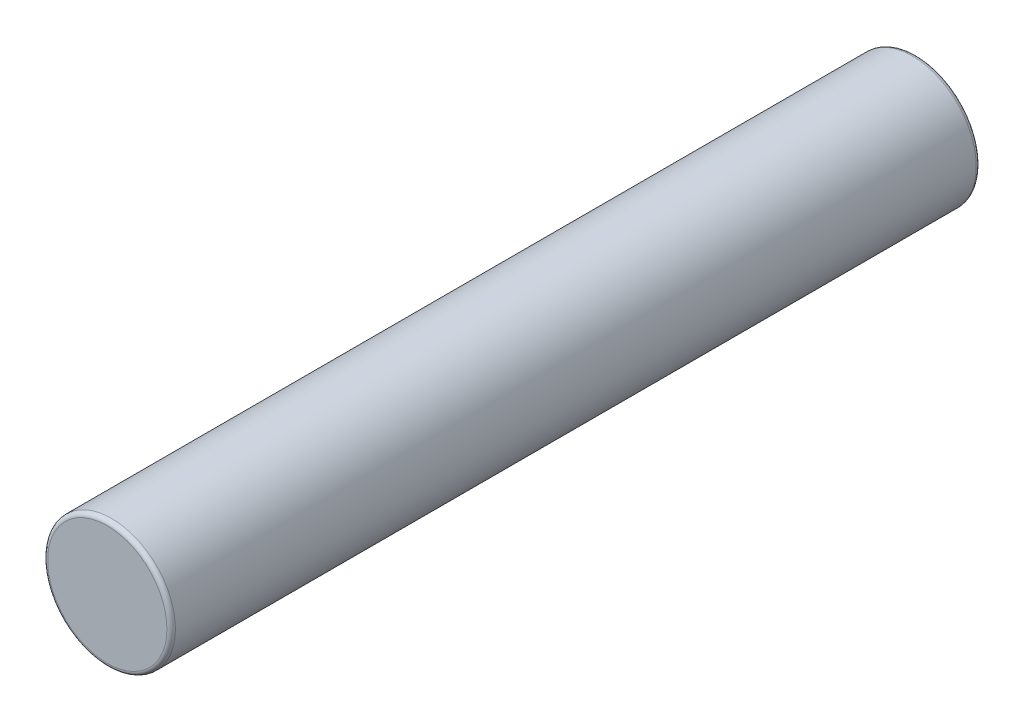
from build123d import *

# Parameters (mm, degrees)
SALIENTE_EXTRUIR1_DEPTH      = 4.75
SALIENTE_EXTRUIR1_DEPTH_BACK = 4.75
CROQUIS1_R                   = 0.75
REDONDEO1_R                  = 0.05


with BuildPart() as part:
    # Croquis1 → Saliente-Extruir1 (new, two sides: drawn at the far end of the back side and taken through both)
    with BuildSketch(Plane.XY.offset(-SALIENTE_EXTRUIR1_DEPTH_BACK)):
        Circle(CROQUIS1_R)
    extrude(amount=SALIENTE_EXTRUIR1_DEPTH + SALIENTE_EXTRUIR1_DEPTH_BACK)

    # Redondeo1
    redondeo1_edges = [part.edges().sort_by_distance(p)[0] for p in [
        (-0.75, 0, -4.75),
        (-0.75, 0, 4.75),
    ]]
    fillet(redondeo1_edges, radius=REDONDEO1_R)


solid = part.part
